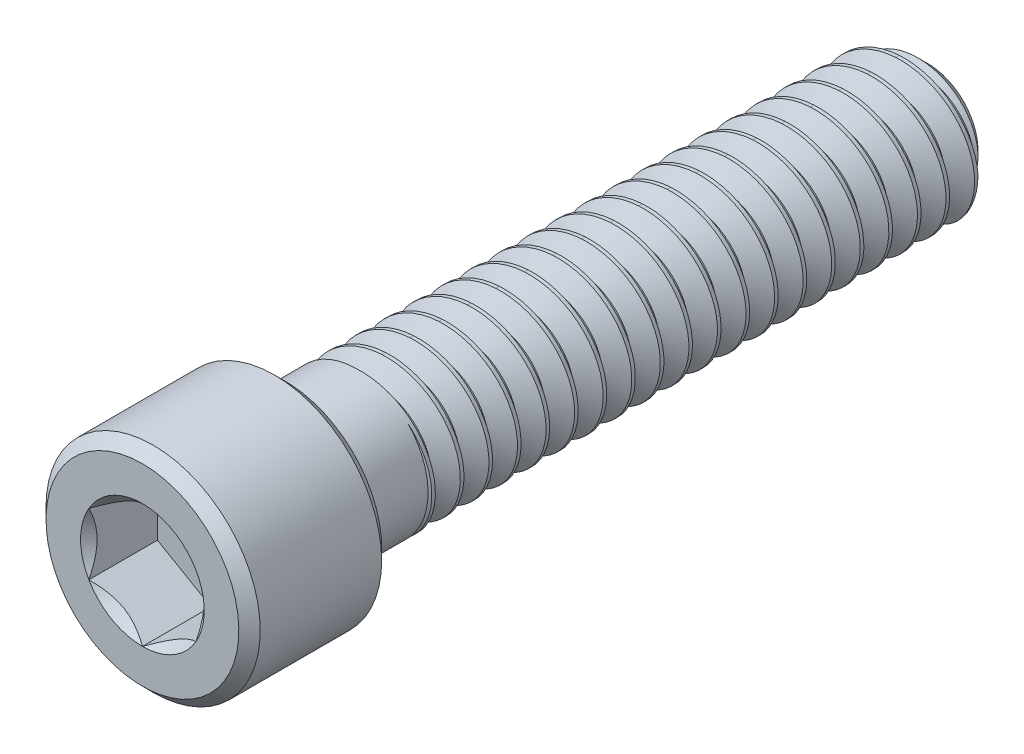
from build123d import *
from build123d.topology import SkipClean

# Parameters (mm, degrees)
CUT_EXTRUDE1_DEPTH  = 3.048
CHAMFER1_SIZE       = 0.47625
CUT_SWEEP1_PITCH    = 1.27
CUT_SWEEP1_TO       = 28.575
SKETCH9_R           = 3.175
BOSS_EXTRUDE2_DEPTH = 3.175


with BuildPart() as part:
    # Sketch3 → Revolve1 (revolve)
    with BuildSketch(Plane(origin=(0, 0, 0), x_dir=(0, 0, -1), z_dir=(1, 0, 0)), mode=Mode.PRIVATE) as revolve1_sk:
        Polygon((-17.4625, 4.7625), (-17.4625, 2.38125), (-14.4145, 2.38125), (-14.4145, 0), (17.4625, 0), (17.4625, 2.2225), (16.51, 3.175), (-11.1125, 3.175), (-11.1125, 4.7625), align=None)
    revolve(revolve1_sk.sketch.rotate(Axis((0, 0, 17.4625), (0, 0, -1)), 180), axis=Axis((0, 0, 17.4625), (0, 0, -1)))

    # Sketch4 → Cut-Extrude1 (cut)
    with BuildSketch(Plane.XY.offset(17.4625)):
        Polygon((0, 2.749630657), (-2.38125, 1.374815329), (-2.38125, -1.374815329), (0, -2.749630657), (2.38125, -1.374815329), (2.38125, 1.374815329), align=None)
    extrude(amount=-CUT_EXTRUDE1_DEPTH, mode=Mode.SUBTRACT)

    # Cut-Extrude2 cone 1 section (through the dimple's axis) → Cut-Extrude2 (revolve, cut)
    with BuildSketch(Plane(origin=(0, 0, 17.4625), x_dir=(0, -1, 0), z_dir=(1, 0, 0))):
        Polygon((0, 0), (2.749630657, 0), (0, 2.749630657), align=None)
    revolve(axis=Axis((0, 0, 17.4625), (0, 0, -1)), mode=Mode.SUBTRACT)

    # Chamfer1
    chamfer1_edges = [part.edges().sort_by_distance(p)[0] for p in [
        (0, 4.7625, 17.4625),
        (0, 4.7625, 11.1125),
    ]]
    chamfer(chamfer1_edges, length=CHAMFER1_SIZE)


with BuildPart() as body_2:
    # Split1: read off the stored shape, not the designer's step
    # Split1: the piece on the far side of the plane
    add(part.part)
    split(bisect_by=Plane.XY.offset(11.1125), keep=Keep.BOTTOM)

    # Cut-Sweep1: arcs per turn and ends read off the stored shape
    # Cut-Sweep1: the profile of Sketch7 screwed along a right-hand helix through 23.5 turns, 8 arcs to a turn; built about Z, then put on its axis
    cut_sweep1_z = Axis((0, 0, 0), (0, 0, 1))
    cut_sweep1_corners = [(2.350110803, 0, -0.47625), (2.350110803, 0, -0.635), (3.243740766, 0, -1.1509375), (3.243740766, 0, 0.0396875)]
    with BuildLine(mode=Mode.PRIVATE) as cut_sweep1_profile:
        Line(cut_sweep1_corners[0], cut_sweep1_corners[1])
        Line(cut_sweep1_corners[1], cut_sweep1_corners[2])
        Line(cut_sweep1_corners[2], cut_sweep1_corners[3])
        Line(cut_sweep1_corners[3], cut_sweep1_corners[0])
    cut_sweep1_cap = Face(cut_sweep1_profile.wire())
    cut_sweep1_turn_angles = [0, 22.5, 45, 67.5, 90, 112.5, 135, 157.5, 180, 202.5, 225, 247.5, 270, 292.5, 315, 337.5, 360]
    cut_sweep1_turn_weights = [1, 0.9238795325112867, 1, 0.9238795325112867, 1, 0.9238795325112867, 1, 0.9238795325112867, 1, 0.9238795325112867, 1, 0.9238795325112867, 1, 0.9238795325112867, 1, 0.9238795325112867, 1]
    cut_sweep1_turn_rails = [Edge.make_bspline([Vector(p[0], p[1], 0).rotate(cut_sweep1_z, cut_sweep1_turn_angles[k]) / cut_sweep1_turn_weights[k] + Vector(0, 0, p[2] + CUT_SWEEP1_PITCH * cut_sweep1_turn_angles[k] / 360) for k in range(17)], [0, 0, 0, 1, 1, 2, 2, 3, 3, 4, 4, 5, 5, 6, 6, 7, 7, 8, 8, 8], 2, cut_sweep1_turn_weights) for p in cut_sweep1_corners]
    cut_sweep1_turn_sides = [Face.make_surface_from_curves(cut_sweep1_turn_rails[p[0]], cut_sweep1_turn_rails[p[1]]) for p in [(0, 1), (1, 2), (2, 3), (3, 0)]]
    cut_sweep1_last_angles = [8280, 8302.5, 8325, 8347.5, 8370, 8392.5, 8415, 8437.5, 8460]
    cut_sweep1_last_weights = [1, 0.9238795325112867, 1, 0.9238795325112867, 1, 0.9238795325112867, 1, 0.9238795325111835, 1]
    cut_sweep1_last_rails = [Edge.make_bspline([Vector(p[0], p[1], 0).rotate(cut_sweep1_z, cut_sweep1_last_angles[k]) / cut_sweep1_last_weights[k] + Vector(0, 0, p[2] + CUT_SWEEP1_PITCH * cut_sweep1_last_angles[k] / 360) for k in range(9)], [0, 0, 0, 1, 1, 2, 2, 3, 3, 4, 4, 4], 2, cut_sweep1_last_weights) for p in cut_sweep1_corners]
    cut_sweep1_last_sides = [Face.make_surface_from_curves(cut_sweep1_last_rails[p[0]], cut_sweep1_last_rails[p[1]]) for p in [(0, 1), (1, 2), (2, 3), (3, 0)]]
    cut_sweep1 = Plane(origin=(0, 0, -17.4625), x_dir=(0, 1, 0), z_dir=(0, 0, 1)) * split(Solid(Shell([*[p.moved(Location((0, 0, CUT_SWEEP1_PITCH * i))) for i in range(23) for p in cut_sweep1_turn_sides], *cut_sweep1_last_sides, cut_sweep1_cap, cut_sweep1_cap.rotate(cut_sweep1_z, 8460).moved(Location((0, 0, CUT_SWEEP1_PITCH * 8460 / 360)))])), bisect_by=Plane.XY.offset(CUT_SWEEP1_TO), keep=Keep.BOTTOM, mode=Mode.PRIVATE)
    add(cut_sweep1, mode=Mode.SUBTRACT)


with BuildPart() as part_1:
    add(part.part)

    # Split1
    split(bisect_by=Plane.XY.offset(11.1125), keep=Keep.TOP)

    add(body_2.part)  # Boss-Extrude1 merges body 2
    # Boss-Extrude1: read off the stored shape, not the designer's step
    # Boss-Extrude1 outline → Boss-Extrude1 (revolve)
    with BuildSketch(Plane.XZ):
        Polygon((2.35010135, 11.1125), (2.35010135, 10.452935832), (3.4925, 11.1125), align=None)
    revolve(axis=Axis((0, 0, 0), (0, 0, 1)))

    # Sketch9 → Boss-Extrude2 (add)
    with SkipClean():  # the faces are left unmerged after this step: merging them gives an invalid solid
        with BuildSketch(Plane(origin=(0, 0, 11.1125), x_dir=(-1, 0, 0), z_dir=(0, 0, -1))):
            with Locations(Location((0, 0, 0), (0, 0, 90))):
                Circle(SKETCH9_R)
        extrude(amount=BOSS_EXTRUDE2_DEPTH)


solid = part_1.part
